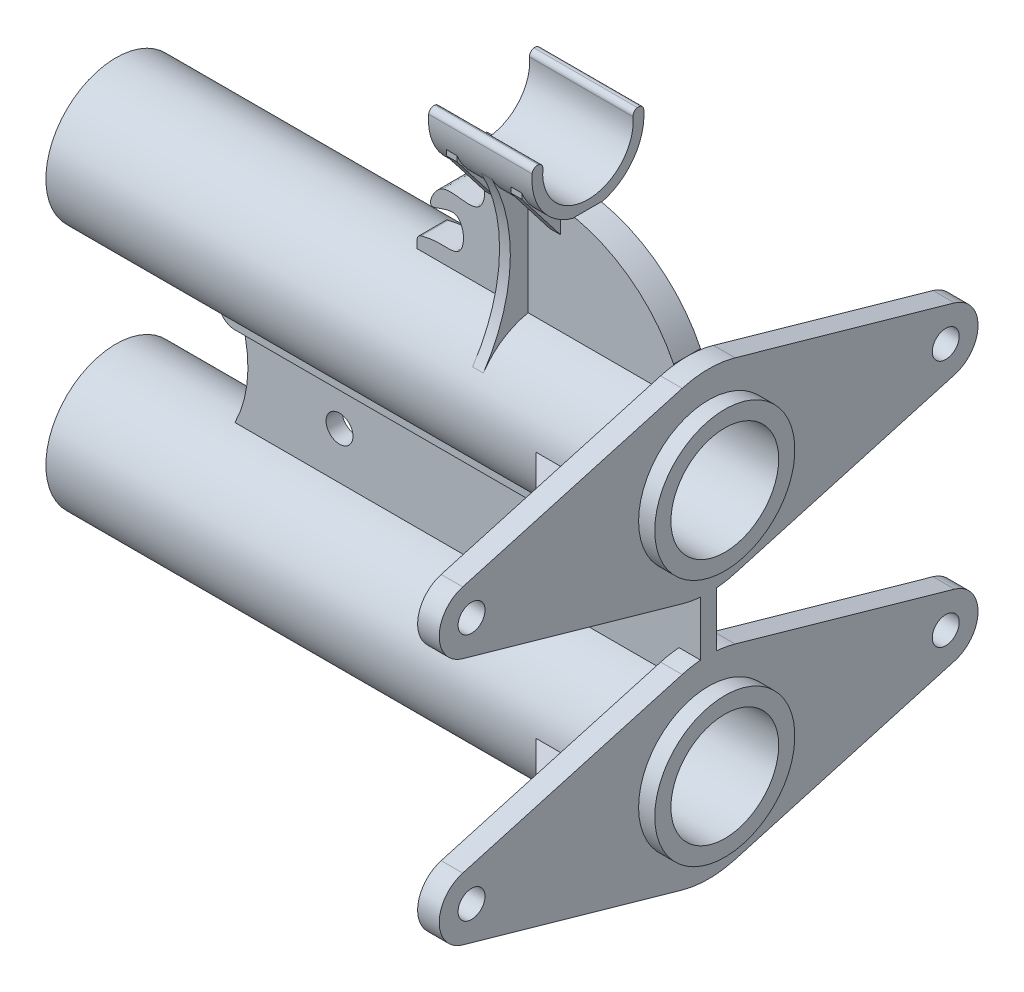
from build123d import *
from build123d.topology import SkipClean

# Parameters (mm, degrees)
SKETCH1_R                = 8.255
BASE_EXTRUDE_DEPTH       = 69.85
SKETCH2_R                = 1.5875
BOSS_EXTRUDE1_DEPTH      = 2.54
SKETCH3_R                = 6.35
CUT_EXTRUDE1_DEPTH       = 78.574028515
SKETCH4_R                = 8.255
SKETCH4_R_2              = 6.35
BOSS_EXTRUDE2_DEPTH      = 1.905
BOSS_EXTRUDE4_DEPTH      = 0.9525
SKETCH5_R                = 1.5875
BOSS_EXTRUDE3_DEPTH      = 0.9525
LPATTERN1_COUNT          = 2
LPATTERN1_PITCH          = 29.21
LPATTERN1_COPY_1_DEPTH   = 0.9525
BOSS_EXTRUDE5_START      = -1.5875
BOSS_EXTRUDE5_DEPTH      = 3.175
FILLET2_R                = 0.635
BOSS_EXTRUDE_THIN1_DEPTH = 6.096
FILLET3_START            = -27
FILLET3_DEPTH            = 14
BOSS_EXTRUDE6_DEPTH      = 0.635
BOSS_EXTRUDE7_DEPTH      = 1.27
BOSS_EXTRUDE8_REACH      = 95.918
BOSS_EXTRUDE8_END_RADIUS = 14.137679687
FILLET4_START            = -4
FILLET4_DEPTH            = 3.0475
MIRROR3_COPY_1_DEPTH     = 1.27


with BuildPart() as part:
    # Sketch1 → Base-Extrude (new body)
    with BuildSketch(Plane(origin=(0, 0, 0), x_dir=(0, 0, -1), z_dir=(1, 0, 0))):
        Circle(SKETCH1_R)
    base_extrude = extrude(amount=-BASE_EXTRUDE_DEPTH)

    # Sketch2 → Boss-Extrude1 (add)
    with BuildSketch(Plane(origin=(0, 0, 0), x_dir=(0, 0, -1), z_dir=(1, 0, 0))):
        with BuildLine():
            Line((-28.979090909, 3.66556818), (-3.117272727, 10.99670454))
            ThreePointArc((-3.117272727, 10.99670454), (0, 11.43), (3.117272727, 10.99670454))
            Line((3.117272727, 10.99670454), (28.979090909, 3.66556818))
            ThreePointArc((28.979090909, 3.66556818), (31.75, 0), (28.979090909, -3.66556818))
            Line((28.979090909, -3.66556818), (3.117272727, -10.99670454))
            ThreePointArc((3.117272727, -10.99670454), (0, -11.43), (-3.117272727, -10.99670454))
            Line((-3.117272727, -10.99670454), (-28.979090909, -3.66556818))
            ThreePointArc((-28.979090909, -3.66556818), (-31.75, 0), (-28.979090909, 3.66556818))
        make_face()
        with Locations((-27.94, 0)):
            Circle(SKETCH2_R, mode=Mode.SUBTRACT)
        with Locations((27.94, 0)):
            Circle(SKETCH2_R, mode=Mode.SUBTRACT)
    boss_extrude1 = extrude(amount=-BOSS_EXTRUDE1_DEPTH)

    # Sketch3 → Cut-Extrude1 (cut, through all)
    with BuildSketch(Plane.ZY.offset(69.85)):
        Circle(SKETCH3_R)
    cut_extrude1 = extrude(amount=-CUT_EXTRUDE1_DEPTH, mode=Mode.SUBTRACT)

    # Sketch4 → Boss-Extrude2 (add)
    with BuildSketch(Plane(origin=(0, 0, 0), x_dir=(0, 0, -1), z_dir=(1, 0, 0))):
        Circle(SKETCH4_R)
        with Locations(Location((0, 0, 0), (0, 0, 180))):
            Circle(SKETCH4_R_2, mode=Mode.SUBTRACT)
    boss_extrude2 = extrude(amount=BOSS_EXTRUDE2_DEPTH)

    # Sketch6 → Boss-Extrude4 (add, symmetric)
    with BuildSketch(Plane(origin=(0, 0, 0), x_dir=(1, 0, 0), z_dir=(0, 1, 0))):
        Polygon((-2.54, 7.3025), (-13.0175, 7.3025), (-2.54, 17.78), align=None)
    boss_extrude4 = extrude(amount=BOSS_EXTRUDE4_DEPTH, both=True)

    # Mirror1: Boss-Extrude4 across plane
    add(boss_extrude4.mirror(Plane.XY))

    # Sketch5 → Boss-Extrude3 (add, symmetric)
    with BuildSketch(Plane.XY):
        with BuildLine():
            Line((0, 7.3025), (-55.372, 7.3025))
            ThreePointArc((-55.372, 7.3025), (-53.34, 14.605), (-55.372, 21.9075))
            Line((-55.372, 21.9075), (0, 21.9075))
            Line((0, 21.9075), (0, 7.3025))
        make_face()
        with Locations(Location((-42.545, 13.7414, 0), (0, 0, 180))):
            Circle(SKETCH5_R, mode=Mode.SUBTRACT)
        with Locations(Location((-12.7, 13.7414, 0), (0, 0, 180))):
            Circle(SKETCH5_R, mode=Mode.SUBTRACT)
    extrude(amount=BOSS_EXTRUDE3_DEPTH, both=True)

    # LPattern1: Base-Extrude, Boss-Extrude1, Cut-Extrude1, Boss-Extrude2, Boss-Extrude4 ×2
    with Locations(*[(0, i * LPATTERN1_PITCH, 0) for i in range(1, LPATTERN1_COUNT)]):
        add(base_extrude)
        add(boss_extrude1)
        add(cut_extrude1, mode=Mode.SUBTRACT)
        add(boss_extrude2)
        add(boss_extrude4)

    # LPattern1 copy 1 sketch → LPattern1 copy 1 (add, symmetric)
    with BuildSketch(Plane(origin=(0, 29.21, 0), x_dir=(1, 0, 0), z_dir=(0, 1, 0))):
        Polygon((-2.54, -7.3025), (-13.0175, -7.3025), (-2.54, -17.78), align=None)
    extrude(amount=LPATTERN1_COPY_1_DEPTH, both=True)

    # Boss-Extrude5: read off the stored shape, not the designer's step
    # Boss-Extrude5 outline → Boss-Extrude5 (add)
    with BuildSketch(Plane.XY.offset(BOSS_EXTRUDE5_START)):
        with BuildLine():
            add(Edge.make_bspline(
                [(-32.766, 38.735), (-31.971942052, 38.946513327), (-30.383826156, 39.369539981), (-26.852160004, 38.753500138), (-27.355692979, 44.679440741), (-31.981747204, 41.413730967), (-30.330427512, 45.316387956), (-27.879599051, 44.969493018), (-24.455585404, 44.62469305), (-24.71150712, 50.554523874), (-29.291866806, 47.483654224), (-28.259380824, 49.336879939), (-28.046460275, 49.88895998), (-27.94, 50.165)],
                knots=[0, 0, 0, 0, 0.094680537, 0.189361074, 0.320714249, 0.425425499, 0.503720214, 0.598400751, 0.693081288, 0.824434463, 0.929145713, 0.964572856, 1, 1, 1, 1], degree=3))
            Line((-32.766, 38.735), (-32.766, 36))
            Line((-32.766, 36), (-2.54, 36))
            Line((-2.54, 36), (-2.54, 40.64))
            ThreePointArc((-2.54, 40.64), (-8.794132972, 47.587887245), (-17.78, 50.165))
            Line((-17.78, 50.165), (-27.94, 50.165))
        make_face()
    extrude(amount=BOSS_EXTRUDE5_DEPTH)

    # Fillet2
    fillet2_edges = [part.edges().sort_by_distance(p)[0] for p in [
        (-27.94, 50.165, 0),
        (-32.766, 38.735, 0),
    ]]
    fillet(fillet2_edges, radius=FILLET2_R)

    # Sketch8 → Boss-Extrude-Thin1 (add, symmetric)
    with BuildSketch(Plane(origin=(-20.32, 0, 0), x_dir=(0, 0, -1), z_dir=(1, 0, 0))):
        with BuildLine():
            ThreePointArc((-6.480734218, 57.404), (0, 49.53), (6.480734218, 57.404))
            Line((6.480734218, 57.404), (5.234439176, 57.159769231))
            ThreePointArc((5.234439176, 57.159769231), (0, 50.8), (-5.234439176, 57.159769231))
            Line((-5.234439176, 57.159769231), (-6.480734218, 57.404))
        make_face()
    extrude(amount=BOSS_EXTRUDE_THIN1_DEPTH, both=True)

    # Fillet3: read off the stored shape, not the designer's step
    # Fillet3 outline → Fillet3 (cut)
    with BuildSketch(Plane.YZ.offset(FILLET3_START)):
        with BuildLine():
            Line((57.159769231, 5.234439176), (57.275370634, 5.824346236))
            ThreePointArc((57.275370634, 5.824346236), (57.034074085, 5.439100965), (56.597092994, 5.313859321))
            ThreePointArc((56.597092994, 5.313859321), (56.879489484, 5.281647606), (57.159769231, 5.234439176))
        make_face()
        with BuildLine():
            ThreePointArc((56.707353231, 6.579063921), (57.159583768, 6.328312593), (57.275370634, 5.824346236))
            Line((57.275370634, 5.824346236), (57.404, 6.480734218))
            ThreePointArc((57.404, 6.480734218), (57.056986981, 6.53918275), (56.707353231, 6.579063921))
        make_face()
        with BuildLine():
            Line((57.404, -6.480734218), (57.275370634, -5.824346236))
            ThreePointArc((57.275370634, -5.824346236), (57.159583768, -6.328312593), (56.707353231, -6.579063921))
            ThreePointArc((56.707353231, -6.579063921), (57.056986981, -6.53918275), (57.404, -6.480734218))
        make_face()
        with BuildLine():
            ThreePointArc((57.159769231, -5.234439176), (56.879489484, -5.281647606), (56.597092994, -5.313859321))
            ThreePointArc((56.597092994, -5.313859321), (57.034074085, -5.439100965), (57.275370634, -5.824346236))
            Line((57.275370634, -5.824346236), (57.159769231, -5.234439176))
        make_face()
    extrude(amount=FILLET3_DEPTH, mode=Mode.SUBTRACT)

    # Sketch9 → Boss-Extrude6 (add, symmetric)
    with BuildSketch(Plane(origin=(-20.32, 0, 0), x_dir=(0, 0, -1), z_dir=(1, 0, 0))):
        with BuildLine():
            Line((1.5875, 37.310917772), (1.5875, 49.723644335))
            ThreePointArc((1.5875, 49.723644335), (4.075401009, 50.937470137), (5.847230444, 53.064356351))
            ThreePointArc((5.847230444, 53.064356351), (3.709260359, 43.290098199), (6.864430713, 33.795260733))
            ThreePointArc((6.864430713, 33.795260733), (4.576979823, 36.079954927), (1.5875, 37.310917772))
        make_face()
    boss_extrude6 = extrude(amount=BOSS_EXTRUDE6_DEPTH, both=True)

    # Sketch10 → Boss-Extrude7 (add)
    with BuildSketch(Plane.ZY.offset(23.495)):
        with BuildLine():
            Line((-1.5875, 47.183644335), (-6.142846058, 53.074488026))
            Line((-6.142846058, 53.074488026), (-6.142846058, 53.709488026))
            ThreePointArc((-6.142846058, 53.709488026), (-4.348712456, 51.163938031), (-1.5875, 49.723644335))
            Line((-1.5875, 49.723644335), (-1.5875, 47.183644335))
        make_face()
    boss_extrude7 = extrude(amount=BOSS_EXTRUDE7_DEPTH)

    # Mirror2: Boss-Extrude7 across plane
    add(boss_extrude7.mirror(Plane(origin=(-20.32, 0, 0), x_dir=(0, 0, 1), z_dir=(1, 0, 0))))

    # Boss-Extrude8: up to this cylinder (the profile starts outside it)
    with SkipClean():  # the faces are left unmerged after this step: merging them gives an invalid solid
        boss_extrude8_end = Plane(origin=(-67.477679687, 14.605, -1.949001), z_dir=(0, 0, -1)) * Cylinder(BOSS_EXTRUDE8_END_RADIUS, 221.111359375, mode=Mode.PRIVATE)
        # Sketch11 → Boss-Extrude8 (add, up to the surface)
        with BuildSketch(Plane.ZY.offset(2.54), mode=Mode.PRIVATE) as boss_extrude8_sk1:
            with BuildLine():
                Line((-0.9525, 19.560342567), (-0.9525, 21.010136053))
                ThreePointArc((-0.9525, 21.010136053), (-1.918548473, 21.18104012), (-2.8575, 21.465342567))
                Line((-2.8575, 21.465342567), (-2.8575, 19.560342567))
                Line((-2.8575, 19.560342567), (-0.9525, 19.560342567))
            make_face()
        boss_extrude8_tool1 = extrude(boss_extrude8_sk1.sketch, amount=BOSS_EXTRUDE8_REACH, mode=Mode.PRIVATE) - boss_extrude8_end
        boss_extrude8 = boss_extrude8_tool1.solids().sort_by_distance((-2.54, 20.384387, -1.949001))[0]
        add(boss_extrude8)

    # Fillet4: read off the stored shape, not the designer's step
    # Fillet4 outline → Fillet4 (cut)
    with SkipClean():  # the faces are left unmerged after this step: merging them gives an invalid solid
        with BuildSketch(Plane.XY.offset(FILLET4_START)):
            with BuildLine():
                Line((-54.236887907, 19.560342567), (-52.975842858, 19.560342567))
                ThreePointArc((-52.975842858, 19.560342567), (-53.994946006, 19.855853898), (-54.697874321, 20.650706057))
                ThreePointArc((-54.697874321, 20.650706057), (-54.455963514, 20.110351472), (-54.236887907, 19.560342567))
            make_face()
        fillet4 = extrude(amount=FILLET4_DEPTH, mode=Mode.SUBTRACT)

    # Mirror3: Boss-Extrude6, Boss-Extrude7, Boss-Extrude8, Fillet4 across plane
    with SkipClean():  # the faces are left unmerged after this step: merging them gives an invalid solid
        add(boss_extrude6.mirror(Plane.XY))
        add(boss_extrude7.mirror(Plane.XY))
        add(boss_extrude8.mirror(Plane.XY))
        add(fillet4.mirror(Plane.XY), mode=Mode.SUBTRACT)

    # Mirror3 copy 1 sketch → Mirror3 copy 1 (add)
    with BuildSketch(Plane(origin=(-17.145, 0, 0), x_dir=(0, 0, -1), z_dir=(1, 0, 0))):
        with BuildLine():
            Line((-1.5875, 47.183644335), (-6.142846058, 53.074488026))
            Line((-6.142846058, 53.074488026), (-6.142846058, 53.709488026))
            ThreePointArc((-6.142846058, 53.709488026), (-4.348712456, 51.163938031), (-1.5875, 49.723644335))
            Line((-1.5875, 49.723644335), (-1.5875, 47.183644335))
        make_face()
    extrude(amount=MIRROR3_COPY_1_DEPTH)


solid = part.part
